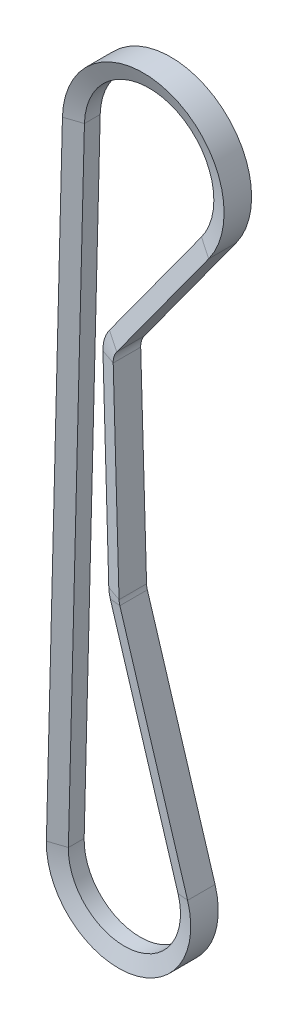
from build123d import *


with BuildPart() as part:
    # Sweep1: sweep along a path in Sketch2
    with BuildLine(Plane.XY) as sweep1_path:
        Line((-24.992025068, 0.631413488), (-19.436103007, 220.540785117))
        ThreePointArc((-19.436103007, 220.540785117), (17.540290244, 246.352725893), (31.210882351, 203.380352723))
        Line((31.210882351, 203.380352723), (-0.646223131, 159.513519245))
        ThreePointArc((-0.646223131, 159.513519245), (-1.575364475, 157.656145121), (-1.855523008, 155.598317755))
        Line((-1.855523008, 155.598317755), (0.171055237, 85.627659758))
        ThreePointArc((0.171055237, 85.627659758), (0.252566133, 84.781010432), (0.446497386, 83.952849955))
        Line((0.446497386, 83.952849955), (23.905102806, 7.317517326))
        ThreePointArc((23.905102806, 7.317517326), (3.386937574, -24.76951057), (-24.992025068, 0.631413488))
    # Sketch3 → Sweep1 (sweep)
    with BuildSketch(Plane(origin=(23.905102806, 7.317517326, 0), x_dir=(-0.9562041122579016, -0.29270069303142865, 0), z_dir=(0.29270069303142865, -0.9562041122579016, 0))):
        Polygon((0, -4.7625), (0, 4.7625), (5.588, 2.728634331), (5.588, -2.728634331), align=None)
    sweep(path=sweep1_path.line)


solid = part.part
